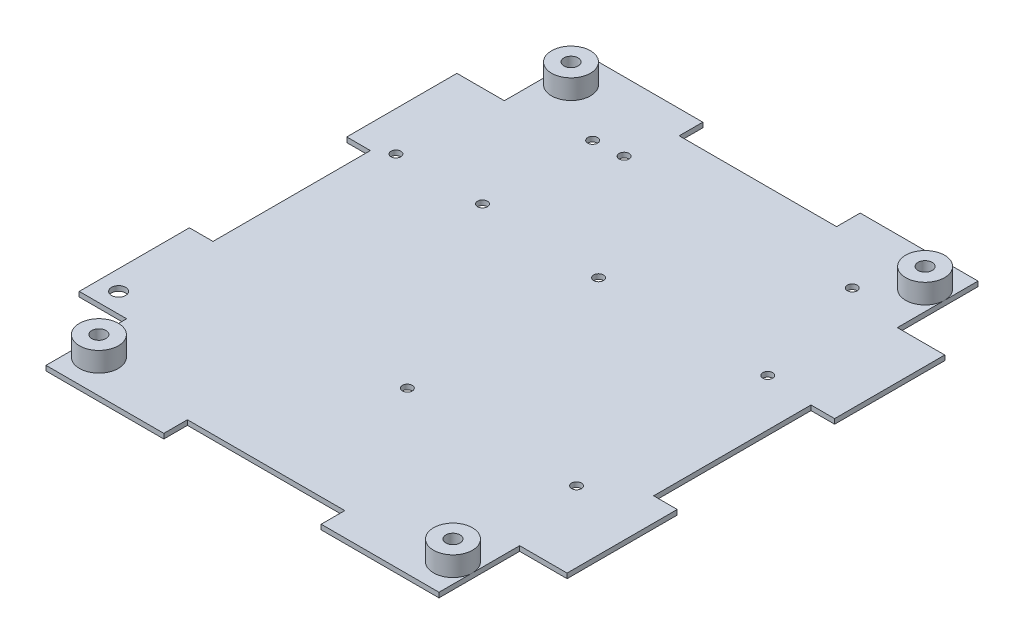
from build123d import *

# Parameters (mm, degrees)
SKETCH1_R           = 2.286
MAIN_BODY_DEPTH     = 1.5875
SKETCH13_R          = 6.28142
SKETCH13_R_2        = 2.286
BOSS_EXTRUDE9_DEPTH = 6.35
CUT_EXTRUDE3_REACH  = 119.509
SKETCH5_R           = 1.5875
SKETCH5_R_2         = 2.286


with BuildPart() as part:
    # Sketch1 → Main Body (new body)
    with BuildSketch(Plane(origin=(0, 0, 0), x_dir=(1, 0, 0), z_dir=(0, 1, 0))):
        Polygon((-25.4, 86.995), (-63.43142, 86.995), (-63.43142, 60.96), (-78.74, 60.96), (-78.74, 25.4), (-71.12, 25.4), (-71.12, -25.4), (-78.74, -25.4), (-78.74, -60.96), (-63.43142, -60.96), (-63.43142, -86.995), (-25.4, -86.995), (-25.4, -79.375), (25.4, -79.375), (25.4, -86.995), (63.43142, -86.995), (63.43142, -60.96), (78.74, -60.96), (78.74, -25.4), (71.12, -25.4), (71.12, 25.4), (78.74, 25.4), (78.74, 60.96), (63.43142, 60.96), (63.43142, 86.995), (25.4, 86.995), (25.4, 79.375), (-25.4, 79.375), align=None)
        with Locations((-57.15, 76.2)):
            Circle(SKETCH1_R, mode=Mode.SUBTRACT)
        with Locations((57.15, 76.2)):
            Circle(SKETCH1_R, mode=Mode.SUBTRACT)
        with Locations((57.15, -76.2)):
            Circle(SKETCH1_R, mode=Mode.SUBTRACT)
        with Locations((-57.15, -76.2)):
            Circle(SKETCH1_R, mode=Mode.SUBTRACT)
    extrude(amount=MAIN_BODY_DEPTH)

    # Sketch13 → Boss-Extrude9 (add)
    # profile 1 of 4: a face of its own
    with BuildSketch(Plane(origin=(0, 1.5875, 0), x_dir=(1, 0, 0), z_dir=(0, 1, 0))):
        with Locations((-57.15, 76.2)):
            Circle(SKETCH13_R)
        with Locations((-57.15, 76.2)):
            Circle(SKETCH13_R_2, mode=Mode.SUBTRACT)
    # profile 2 of 4: a face of its own
    with BuildSketch(Plane(origin=(0, 1.5875, 0), x_dir=(1, 0, 0), z_dir=(0, 1, 0))):
        with Locations((-57.15, -76.2)):
            Circle(SKETCH13_R)
        with Locations((-57.15, -76.2)):
            Circle(SKETCH13_R_2, mode=Mode.SUBTRACT)
    # profile 3 of 4: a face of its own
    with BuildSketch(Plane(origin=(0, 1.5875, 0), x_dir=(1, 0, 0), z_dir=(0, 1, 0))):
        with Locations((57.15, -76.2)):
            Circle(SKETCH13_R)
        with Locations((57.15, -76.2)):
            Circle(SKETCH13_R_2, mode=Mode.SUBTRACT)
    # profile 4 of 4: a face of its own
    with BuildSketch(Plane(origin=(0, 1.5875, 0), x_dir=(1, 0, 0), z_dir=(0, 1, 0))):
        with Locations((57.15, 76.2)):
            Circle(SKETCH13_R)
        with Locations((57.15, 76.2)):
            Circle(SKETCH13_R_2, mode=Mode.SUBTRACT)
    extrude(amount=BOSS_EXTRUDE9_DEPTH)

    # Sketch5 → Cut-Extrude3 (cut, up to next)
    with BuildSketch(Plane(origin=(0, 1.5875, 0), x_dir=(1, 0, 0), z_dir=(0, 1, 0)), mode=Mode.PRIVATE) as cut_extrude3_sk1:
        with Locations((1.27, 26.67)):
            Circle(SKETCH5_R)
    cut_extrude3_tool1 = extrude(cut_extrude3_sk1.sketch, amount=-CUT_EXTRUDE3_REACH, mode=Mode.PRIVATE) & part.part
    # Sketch5 → Cut-Extrude3 (cut, up to next)
    with BuildSketch(Plane(origin=(0, 1.5875, 0), x_dir=(1, 0, 0), z_dir=(0, 1, 0)), mode=Mode.PRIVATE) as cut_extrude3_sk2:
        with Locations((55.88, 26.67)):
            Circle(SKETCH5_R)
    cut_extrude3_tool2 = extrude(cut_extrude3_sk2.sketch, amount=-CUT_EXTRUDE3_REACH, mode=Mode.PRIVATE) & part.part
    # Sketch5 → Cut-Extrude3 (cut, up to next)
    with BuildSketch(Plane(origin=(0, 1.5875, 0), x_dir=(1, 0, 0), z_dir=(0, 1, 0)), mode=Mode.PRIVATE) as cut_extrude3_sk3:
        with Locations((55.88, -35.052)):
            Circle(SKETCH5_R)
    cut_extrude3_tool3 = extrude(cut_extrude3_sk3.sketch, amount=-CUT_EXTRUDE3_REACH, mode=Mode.PRIVATE) & part.part
    # Sketch5 → Cut-Extrude3 (cut, up to next)
    with BuildSketch(Plane(origin=(0, 1.5875, 0), x_dir=(1, 0, 0), z_dir=(0, 1, 0)), mode=Mode.PRIVATE) as cut_extrude3_sk4:
        with Locations((1.27, -35.052)):
            Circle(SKETCH5_R)
    cut_extrude3_tool4 = extrude(cut_extrude3_sk4.sketch, amount=-CUT_EXTRUDE3_REACH, mode=Mode.PRIVATE) & part.part
    # Sketch5 → Cut-Extrude3 (cut, up to next)
    with BuildSketch(Plane(origin=(0, 1.5875, 0), x_dir=(1, 0, 0), z_dir=(0, 1, 0)), mode=Mode.PRIVATE) as cut_extrude3_sk5:
        with Locations((-28.575, 64.77)):
            Circle(SKETCH5_R)
    cut_extrude3_tool5 = extrude(cut_extrude3_sk5.sketch, amount=-CUT_EXTRUDE3_REACH, mode=Mode.PRIVATE) & part.part
    # Sketch5 → Cut-Extrude3 (cut, up to next)
    with BuildSketch(Plane(origin=(0, 1.5875, 0), x_dir=(1, 0, 0), z_dir=(0, 1, 0)), mode=Mode.PRIVATE) as cut_extrude3_sk6:
        with Locations((45.085, 64.77)):
            Circle(SKETCH5_R)
    cut_extrude3_tool6 = extrude(cut_extrude3_sk6.sketch, amount=-CUT_EXTRUDE3_REACH, mode=Mode.PRIVATE) & part.part
    # Sketch5 → Cut-Extrude3 (cut, up to next)
    with BuildSketch(Plane(origin=(0, 1.5875, 0), x_dir=(1, 0, 0), z_dir=(0, 1, 0)), mode=Mode.PRIVATE) as cut_extrude3_sk7:
        with Locations((-66.04, 28.575)):
            Circle(SKETCH5_R)
    cut_extrude3_tool7 = extrude(cut_extrude3_sk7.sketch, amount=-CUT_EXTRUDE3_REACH, mode=Mode.PRIVATE) & part.part
    # Sketch5 → Cut-Extrude3 (cut, up to next)
    with BuildSketch(Plane(origin=(0, 1.5875, 0), x_dir=(1, 0, 0), z_dir=(0, 1, 0)), mode=Mode.PRIVATE) as cut_extrude3_sk8:
        with Locations((-38.1, 64.135)):
            Circle(SKETCH5_R)
    cut_extrude3_tool8 = extrude(cut_extrude3_sk8.sketch, amount=-CUT_EXTRUDE3_REACH, mode=Mode.PRIVATE) & part.part
    # Sketch5 → Cut-Extrude3 (cut, up to next)
    with BuildSketch(Plane(origin=(0, 1.5875, 0), x_dir=(1, 0, 0), z_dir=(0, 1, 0)), mode=Mode.PRIVATE) as cut_extrude3_sk9:
        with Locations((-38.1, 28.575)):
            Circle(SKETCH5_R)
    cut_extrude3_tool9 = extrude(cut_extrude3_sk9.sketch, amount=-CUT_EXTRUDE3_REACH, mode=Mode.PRIVATE) & part.part
    # Sketch5 → Cut-Extrude3 (cut, up to next)
    with BuildSketch(Plane(origin=(0, 1.5875, 0), x_dir=(1, 0, 0), z_dir=(0, 1, 0)), mode=Mode.PRIVATE) as cut_extrude3_sk10:
        with Locations((-72.39, -54.61)):
            Circle(SKETCH5_R_2)
    cut_extrude3_tool10 = extrude(cut_extrude3_sk10.sketch, amount=-CUT_EXTRUDE3_REACH, mode=Mode.PRIVATE) & part.part
    add(cut_extrude3_tool1.solids().sort_by_distance((1.27, 1.5875, -26.67))[0], mode=Mode.SUBTRACT)
    add(cut_extrude3_tool2.solids().sort_by_distance((55.88, 1.5875, -26.67))[0], mode=Mode.SUBTRACT)
    add(cut_extrude3_tool3.solids().sort_by_distance((55.88, 1.5875, 35.052))[0], mode=Mode.SUBTRACT)
    add(cut_extrude3_tool4.solids().sort_by_distance((1.27, 1.5875, 35.052))[0], mode=Mode.SUBTRACT)
    add(cut_extrude3_tool5.solids().sort_by_distance((-28.575, 1.5875, -64.77))[0], mode=Mode.SUBTRACT)
    add(cut_extrude3_tool6.solids().sort_by_distance((45.085, 1.5875, -64.77))[0], mode=Mode.SUBTRACT)
    add(cut_extrude3_tool7.solids().sort_by_distance((-66.04, 1.5875, -28.575))[0], mode=Mode.SUBTRACT)
    add(cut_extrude3_tool8.solids().sort_by_distance((-38.1, 1.5875, -64.135))[0], mode=Mode.SUBTRACT)
    add(cut_extrude3_tool9.solids().sort_by_distance((-38.1, 1.5875, -28.575))[0], mode=Mode.SUBTRACT)
    add(cut_extrude3_tool10.solids().sort_by_distance((-72.39, 1.5875, 54.61))[0], mode=Mode.SUBTRACT)


solid = part.part
